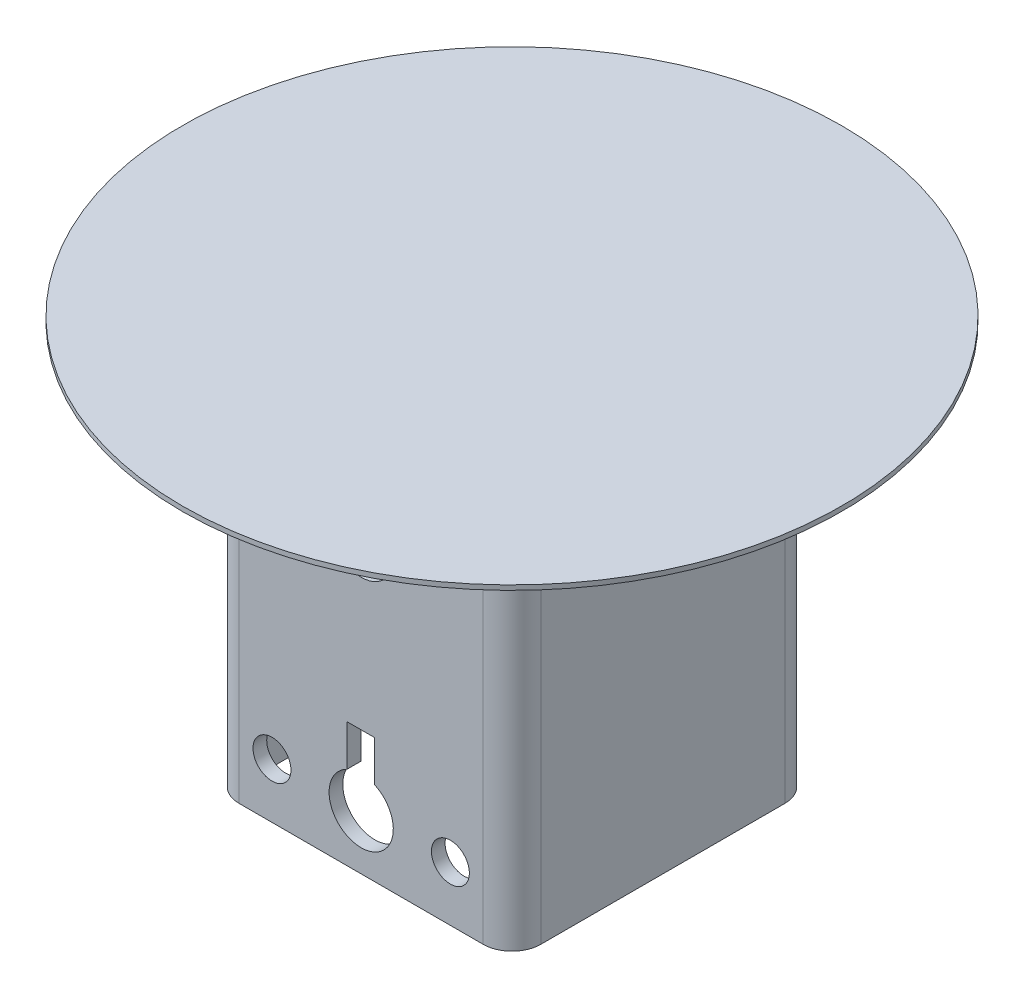
from build123d import *

# Parameters (mm, degrees)
SKETCH3_W               = 38.2050925
SKETCH3_H               = 0.551638054
BOSS_EXTRUDE1_DEPTH     = 46.736
CUT_EXTRUDE1_DEPTH      = 365.000734219
CUT_EXTRUDE1_DEPTH_BACK = 365.000734219
SKETCH5_R               = 2.200841193
SCALE1_SCALE            = 2.1025641


with BuildPart() as part:
    # Sketch3 → Revolve1 (revolve)
    with BuildSketch(Plane.XY):
        with Locations((-176.077749649, -229.697714421)):
            Rectangle(SKETCH3_W, SKETCH3_H)
    revolve(axis=Axis((-195.180295899, -229.973533448, 0), (0, 1, 0)))

    # Sketch4 → Boss-Extrude1 (add)
    with BuildSketch(Plane.XZ.offset(229.973533448)):
        with BuildLine():
            Line((-209.32977738, -17.483231481), (-181.030814417, -17.483231481))
            ThreePointArc((-181.030814417, -17.483231481), (-178.673497186, -16.506798713), (-177.697064417, -14.149481481))
            Line((-177.697064417, -14.149481481), (-177.697064417, 14.149481481))
            ThreePointArc((-177.697064417, 14.149481481), (-178.673497186, 16.506798713), (-181.030814417, 17.483231481))
            Line((-181.030814417, 17.483231481), (-209.32977738, 17.483231481))
            ThreePointArc((-209.32977738, 17.483231481), (-211.687094612, 16.506798713), (-212.66352738, 14.149481481))
            Line((-212.66352738, 14.149481481), (-212.66352738, -14.149481481))
            ThreePointArc((-212.66352738, -14.149481481), (-211.687094612, -16.506798713), (-209.32977738, -17.483231481))
        make_face()
        with BuildLine():
            Line((-211.07602738, -13.355731481), (-211.07602738, 13.355731481))
            ThreePointArc((-211.07602738, 13.355731481), (-210.332078604, 15.151782705), (-208.53602738, 15.895731481))
            Line((-208.53602738, 15.895731481), (-181.824564417, 15.895731481))
            ThreePointArc((-181.824564417, 15.895731481), (-180.028513193, 15.151782705), (-179.284564417, 13.355731481))
            Line((-179.284564417, 13.355731481), (-179.284564417, -13.355731481))
            ThreePointArc((-179.284564417, -13.355731481), (-180.028513193, -15.151782705), (-181.824564417, -15.895731481))
            Line((-181.824564417, -15.895731481), (-208.53602738, -15.895731481))
            ThreePointArc((-208.53602738, -15.895731481), (-210.332078604, -15.151782705), (-211.07602738, -13.355731481))
        make_face(mode=Mode.SUBTRACT)
    extrude(amount=BOSS_EXTRUDE1_DEPTH)

    # Sketch5 → Cut-Extrude1 (cut, two sides: drawn at the far end of the back side and taken through both)
    with BuildSketch(Plane.XY.offset(-CUT_EXTRUDE1_DEPTH_BACK)):
        with BuildLine():
            Line((-196.813996528, -262.2471497), (-196.813996528, -267.015063616))
            ThreePointArc((-196.813996528, -267.015063616), (-195.140241919, -274.081475398), (-193.618948859, -266.980679852))
            Line((-193.618948859, -266.980679852), (-193.618948859, -262.2471497))
            Line((-193.618948859, -262.2471497), (-196.813996528, -262.2471497))
        make_face()
        with BuildLine():
            Line((-196.813996528, -235.096274088), (-196.813996528, -239.864188004))
            ThreePointArc((-196.813996528, -239.864188004), (-195.140241919, -246.930599786), (-193.618948859, -239.82980424))
            Line((-193.618948859, -239.82980424), (-193.618948859, -235.096274088))
            Line((-193.618948859, -235.096274088), (-196.813996528, -235.096274088))
        make_face()
        with Locations((-205.51977738, -270.359533448)):
            Circle(SKETCH5_R)
        with Locations((-205.51977738, -239.498533448)):
            Circle(SKETCH5_R)
        with Locations((-184.840814417, -239.498533448)):
            Circle(SKETCH5_R)
        with Locations((-184.840814417, -270.359533448)):
            Circle(SKETCH5_R)
    extrude(amount=CUT_EXTRUDE1_DEPTH + CUT_EXTRUDE1_DEPTH_BACK, mode=Mode.SUBTRACT)


with BuildPart() as part_1:
    # Scale1: scaled about (0, 0, 0)
    add(part.part.scale(SCALE1_SCALE))


solid = part_1.part
